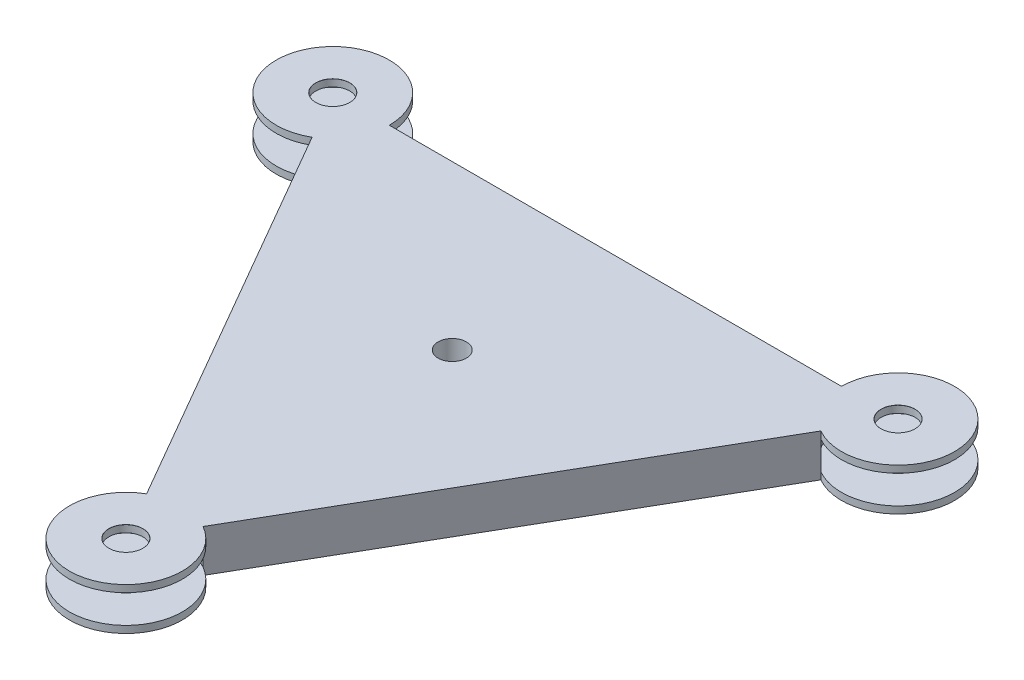
from build123d import *

# Parameters (mm, degrees)
ESQUISSE1_R                 = 5
BOSS_EXTRU_1_DEPTH          = 7.5
ESQUISSE7_R                 = 20
ENL_V_MAT_EXTRU_1_DEPTH     = 5
D_GAGEMENT_M102_D           = 12
D_GAGEMENT_M102_CSINK_D     = 12.05
D_GAGEMENT_M102_CSINK_ANGLE = 90


with BuildPart() as part:
    # Esquisse1 → Boss.-Extru.1 (new, symmetric)
    with BuildSketch(Plane(origin=(0, 0, 0), x_dir=(1, 0, 0), z_dir=(0, 1, 0))):
        with BuildLine():
            Line((80, 57.735026919), (-80, 57.735026919))
            ThreePointArc((-80, 57.735026919), (-117.320508076, 67.735026919), (-90, 40.414518843))
            Line((-90, 40.414518843), (-10, -98.149545762))
            ThreePointArc((-10, -98.149545762), (0, -135.470053838), (10, -98.149545762))
            Line((10, -98.149545762), (90, 40.414518843))
            ThreePointArc((90, 40.414518843), (117.320508076, 67.735026919), (80, 57.735026919))
        make_face()
        Circle(ESQUISSE1_R, mode=Mode.SUBTRACT)
    extrude(amount=BOSS_EXTRU_1_DEPTH, both=True)

    # Esquisse7 → Enlèv. mat.-Extru.1 (cut, symmetric)
    with BuildSketch(Plane(origin=(0, 0, 0), x_dir=(1, 0, 0), z_dir=(0, 1, 0))):
        with Locations((0, -115.470053838)):
            Circle(ESQUISSE7_R)
        with Locations((100, 57.735026919)):
            Circle(ESQUISSE7_R)
        with Locations((-100, 57.735026919)):
            Circle(ESQUISSE7_R)
    extrude(amount=ENL_V_MAT_EXTRU_1_DEPTH, both=True, mode=Mode.SUBTRACT)

    # Dégagement M102 (through all)
    with Locations(Plane(origin=(0, 7.5, 0), x_dir=(1, 0, 0), z_dir=(0, 1, 0))):
        with Locations((-100, 57.735026919), (100, 57.735026919), (0, -115.470053838)):
            CounterSinkHole(D_GAGEMENT_M102_D / 2, D_GAGEMENT_M102_CSINK_D / 2, counter_sink_angle=D_GAGEMENT_M102_CSINK_ANGLE)


solid = part.part
